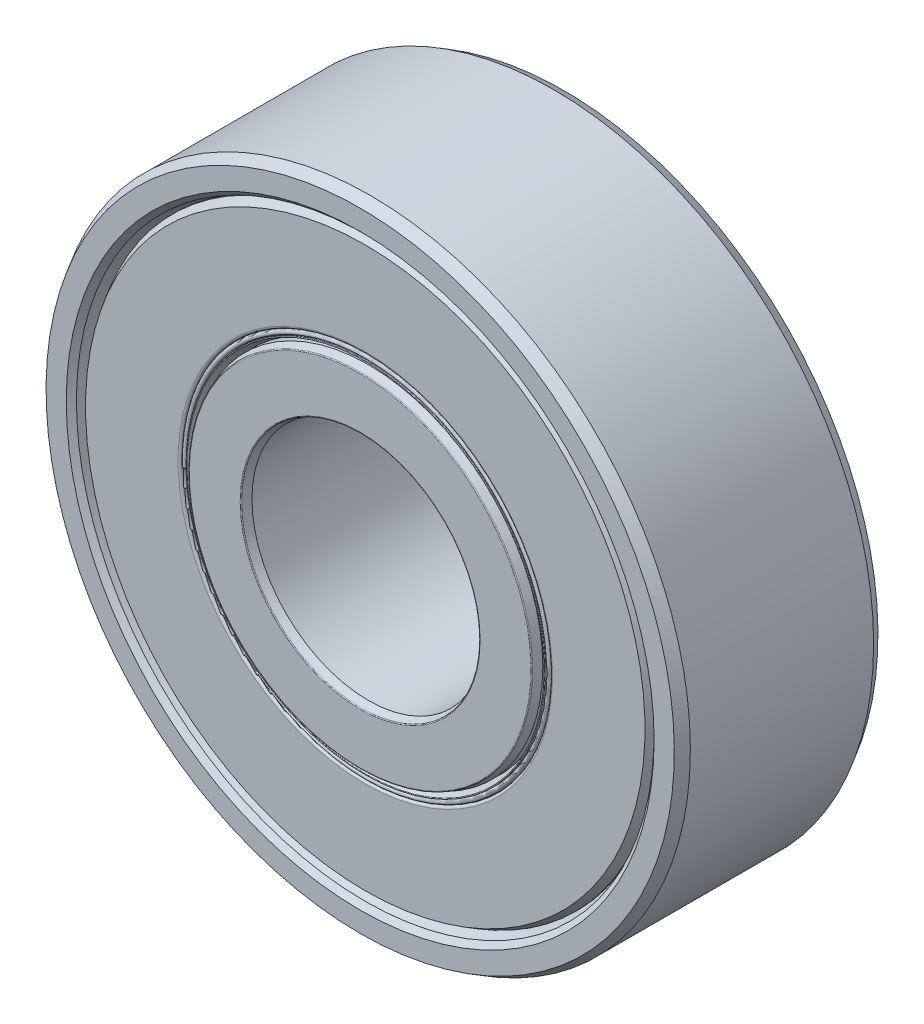
from build123d import *

# Parameters (mm, degrees)
CIRPATTERN1_COUNT = 7


with BuildPart() as part:
    # Sketch3 → Revolve1 (revolve)
    with BuildSketch(Plane(origin=(0, 0, 0), x_dir=(0, 0, -1), z_dir=(1, 0, 0))):
        with BuildLine():
            Line((-2.945227749, 9.79), (-3.325, 9.928225795))
            Line((-3.325, 9.928225795), (-3.5, 10.103225795))
            Line((-3.5, 10.103225795), (-3.5, 10.797927406))
            Line((-3.5, 10.797927406), (-3.15, 11))
            Line((-3.15, 11), (3.15, 11))
            Line((3.15, 11), (3.5, 10.797927406))
            Line((3.5, 10.797927406), (3.5, 10.103225795))
            Line((3.5, 10.103225795), (3.325, 9.928225795))
            Line((3.325, 9.928225795), (2.945227749, 9.79))
            Line((2.945227749, 9.79), (1.631, 9.79))
            ThreePointArc((1.631, 9.79), (0, 10.395), (-1.631, 9.79))
            Line((-1.631, 9.79), (-2.945227749, 9.79))
        make_face()
    revolve(axis=Axis((0, 0, 3.5), (0, 0, -1)))


with BuildPart() as body_2:
    # Sketch4 → Revolve2 (revolve)
    with BuildSketch(Plane(origin=(0, 0, 0), x_dir=(0, 0, -1), z_dir=(1, 0, 0))):
        with BuildLine():
            Line((-3.22, 4), (-3.476970705, 4.093529688))
            ThreePointArc((-3.476970705, 4.093529688), (-3.493670322, 4.106343754), (-3.5, 4.126418929))
            Line((-3.5, 4.126418929), (-3.5, 5.87162074))
            ThreePointArc((-3.5, 5.87162074), (-3.493670322, 5.891695915), (-3.476970705, 5.904509982))
            Line((-3.476970705, 5.904509982), (-3.22, 5.998039669))
            Line((-3.22, 5.998039669), (-1.631, 5.998039669))
            ThreePointArc((-1.631, 5.998039669), (0, 5.393039669), (1.631, 5.998039669))
            Line((1.631, 5.998039669), (3.22, 5.998039669))
            Line((3.22, 5.998039669), (3.476970705, 5.904509982))
            ThreePointArc((3.476970705, 5.904509982), (3.493670322, 5.891695915), (3.5, 5.87162074))
            Line((3.5, 5.87162074), (3.5, 4.126418929))
            ThreePointArc((3.5, 4.126418929), (3.493670322, 4.106343754), (3.476970705, 4.093529688))
            Line((3.476970705, 4.093529688), (3.22, 4))
            Line((3.22, 4), (-3.22, 4))
        make_face()
    revolve(axis=Axis((0, 0, 3.5), (0, 0, -1)))


with BuildPart() as body_3:
    # Sketch5 → Revolve3 (revolve)
    with BuildSketch(Plane(origin=(0, 0, 0), x_dir=(0, 0, -1), z_dir=(1, 0, 0))):
        with BuildLine():
            Line((-2.500980165, 7.894019835), (2.500980165, 7.894019835))
            ThreePointArc((2.500980165, 7.894019835), (0, 10.395), (-2.500980165, 7.894019835))
        make_face()
    revolve(axis=Axis((0, 7.894019835, 2.500980165), (0, 0, -1)))


with BuildPart() as cirpattern1_1:
    # CirPattern1: pattern copy
    add(body_3.part.rotate(Axis((0, 0, 3.5), (0, 0, -1)), 1 * 360 / CIRPATTERN1_COUNT))


with BuildPart() as cirpattern1_2:
    # CirPattern1: pattern copy
    add(body_3.part.rotate(Axis((0, 0, 3.5), (0, 0, -1)), 2 * 360 / CIRPATTERN1_COUNT))


with BuildPart() as cirpattern1_3:
    # CirPattern1: pattern copy
    add(body_3.part.rotate(Axis((0, 0, 3.5), (0, 0, -1)), 3 * 360 / CIRPATTERN1_COUNT))


with BuildPart() as cirpattern1_4:
    # CirPattern1: pattern copy
    add(body_3.part.rotate(Axis((0, 0, 3.5), (0, 0, -1)), 4 * 360 / CIRPATTERN1_COUNT))


with BuildPart() as cirpattern1_5:
    # CirPattern1: pattern copy
    add(body_3.part.rotate(Axis((0, 0, 3.5), (0, 0, -1)), 5 * 360 / CIRPATTERN1_COUNT))


with BuildPart() as cirpattern1_6:
    # CirPattern1: pattern copy
    add(body_3.part.rotate(Axis((0, 0, 3.5), (0, 0, -1)), 6 * 360 / CIRPATTERN1_COUNT))


with BuildPart() as body_10:
    # Sketch6 → Revolve4 (revolve)
    with BuildSketch(Plane(origin=(0, 0, 0), x_dir=(0, 0, -1), z_dir=(1, 0, 0))):
        with BuildLine():
            Line((-3.021891109, 9.79), (-2.500980165, 9.79))
            Line((-2.500980165, 9.79), (-2.500980165, 6.348039669))
            Line((-2.500980165, 6.348039669), (-3.2375, 6.348039669))
            ThreePointArc((-3.2375, 6.348039669), (-3.299371843, 6.373667826), (-3.325, 6.435539669))
            Line((-3.325, 6.435539669), (-3.325, 9.615))
            Line((-3.325, 9.615), (-3.021891109, 9.79))
        make_face()
        with BuildLine():
            Line((3.2375, 6.348039669), (2.500980165, 6.348039669))
            Line((2.500980165, 6.348039669), (2.500980165, 9.79))
            Line((2.500980165, 9.79), (3.021891109, 9.79))
            Line((3.021891109, 9.79), (3.325, 9.615))
            Line((3.325, 9.615), (3.325, 6.435539669))
            ThreePointArc((3.325, 6.435539669), (3.299371843, 6.373667826), (3.2375, 6.348039669))
        make_face()
    revolve(axis=Axis((0, 0, 3.5), (0, 0, -1)))


with BuildPart() as body_11:
    # Sketch7 → Revolve5 (revolve)
    with BuildSketch(Plane(origin=(0, 0, 0), x_dir=(0, 0, -1), z_dir=(1, 0, 0))):
        with BuildLine():
            Line((-2.500980165, 5.998039669), (-2.925938883, 5.998039669))
            Line((-2.925938883, 5.998039669), (-3.313485353, 6.139095049))
            ThreePointArc((-3.313485353, 6.139095049), (-3.324734136, 6.158578513), (-3.3075, 6.173039669))
            Line((-3.3075, 6.173039669), (-3.2375, 6.173039669))
            ThreePointArc((-3.2375, 6.173039669), (-3.325, 6.260539669), (-3.2375, 6.348039669))
            Line((-3.2375, 6.348039669), (-2.500980165, 6.348039669))
            Line((-2.500980165, 6.348039669), (-2.500980165, 5.998039669))
        make_face()
        with BuildLine():
            Line((2.500980165, 6.348039669), (2.500980165, 5.998039669))
            Line((2.500980165, 5.998039669), (2.925938883, 5.998039669))
            Line((2.925938883, 5.998039669), (3.313485353, 6.139095049))
            ThreePointArc((3.313485353, 6.139095049), (3.324734136, 6.158578513), (3.3075, 6.173039669))
            Line((3.3075, 6.173039669), (3.2375, 6.173039669))
            ThreePointArc((3.2375, 6.173039669), (3.325, 6.260539669), (3.2375, 6.348039669))
            Line((3.2375, 6.348039669), (2.500980165, 6.348039669))
        make_face()
    revolve(axis=Axis((0, 0, 3.5), (0, 0, -1)))


solid = Compound([part.part, body_2.part, body_3.part, cirpattern1_1.part, cirpattern1_2.part, cirpattern1_3.part, cirpattern1_4.part, cirpattern1_5.part, cirpattern1_6.part, body_10.part, body_11.part])
